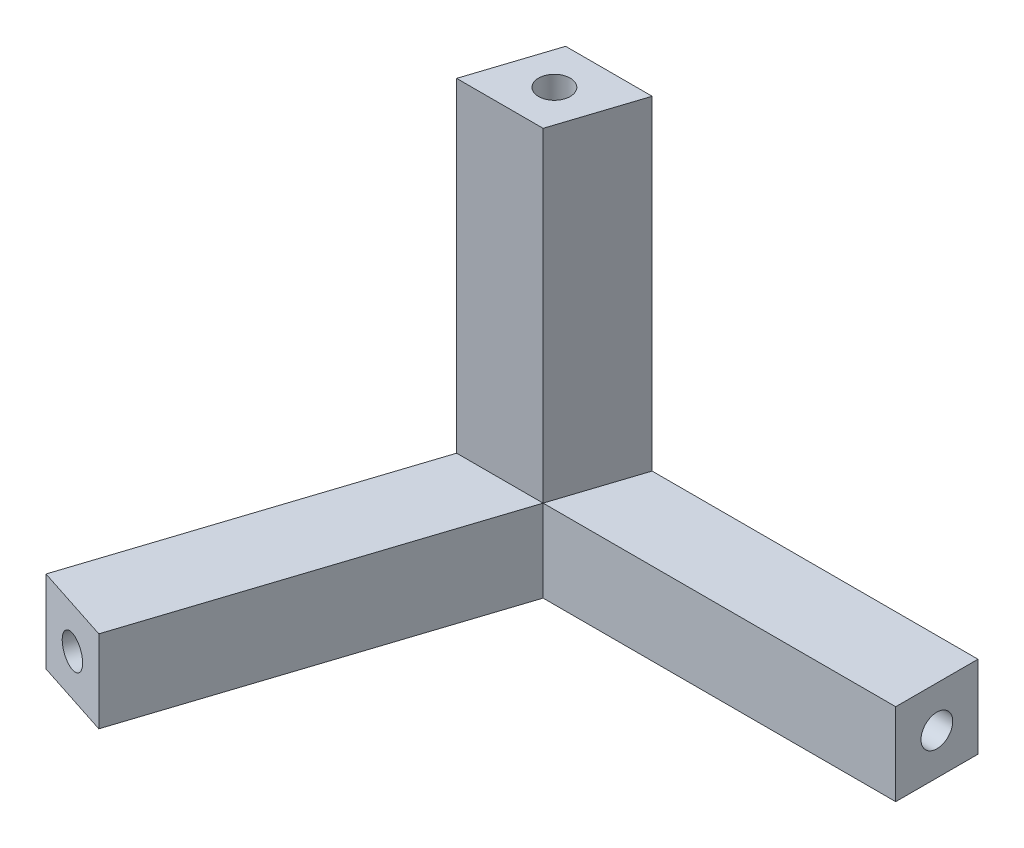
from build123d import *

# Parameters (mm, degrees)
BOSS_EXTRUDE1_DEPTH  = 1.75
SKETCH3_R            = 0.675
CUT_EXTRUDE1_DEPTH   = 15
SKETCH4_R            = 0.675
CUT_EXTRUDE2_DEPTH   = 15
CUT_SWEEP1_START     = 1.740413317
CUT_SWEEP1_OUTLINE_R = 0.675
CUT_SWEEP1_DEPTH     = 15.070945459


# Read off the part's stored shape, not the designer's step: Cut-Sweep1
with BuildPart() as part:
    # Sketch2 → Boss-Extrude1 (new, symmetric)
    with BuildSketch(Plane(origin=(0, 0, 0), x_dir=(1, 0, 0), z_dir=(0, 1, 0))):
        Polygon((-1.271449424, 1.75), (-6.692503299, -14.934288264), (-3.363805492, -16.015847744), (1.271449424, -1.75), (16.271449424, -1.75), (16.271449424, 1.75), align=None)
    extrude(amount=BOSS_EXTRUDE1_DEPTH, both=True)

    # Sketch3 → Cut-Extrude1 (cut)
    with BuildSketch(Plane(origin=(-5.028154395, 0, 15.475068004), x_dir=(0.9510565162951536, 0, 0.3090169943749472), z_dir=(-0.3090169943749472, 0, 0.9510565162951536))):
        Circle(SKETCH3_R)
    extrude(amount=-CUT_EXTRUDE1_DEPTH, mode=Mode.SUBTRACT)

    # Sketch4 → Cut-Extrude2 (cut)
    with BuildSketch(Plane(origin=(16.271449424, 0, 0), x_dir=(0, 0, -1), z_dir=(1, 0, 0))):
        Circle(SKETCH4_R)
    extrude(amount=-CUT_EXTRUDE2_DEPTH, mode=Mode.SUBTRACT)

    # Sweep1: sweep along a path in Sketch7
    with BuildLine(Plane(origin=(0, 0, 0), x_dir=(0.7071067811865477, 0, 0.7071067811865475), z_dir=(-0.7071067811865475, 0, 0.7071067811865477))) as sweep1_path:
        Line((0, 1.75), (1.567926949, 16.667828431))
    # Sketch5 → Sweep1 (sweep)
    with BuildSketch(Plane(origin=(0, 1.75, 0), x_dir=(1, 0, 0), z_dir=(0, 1, 0))):
        Polygon((1.271449424, -1.75), (-2.408668361, -1.75), (-1.271449424, 1.75), (2.408668361, 1.75), align=None)
    sweep(path=sweep1_path.line)

    # Cut-Sweep1 outline → Cut-Sweep1 (cut)
    with BuildSketch(Plane(origin=(0, 0, 0), x_dir=(0.9972647091838012, -0.07370950015142784, -0.0054780839693199055), z_dir=(0.07391278520356448, 0.9945218953682737, 0.07391278520356448)).offset(CUT_SWEEP1_START)):
        with Locations((-0.128991625, 0.129702147)):
            Circle(CUT_SWEEP1_OUTLINE_R)
    extrude(amount=CUT_SWEEP1_DEPTH, mode=Mode.SUBTRACT)


solid = part.part
